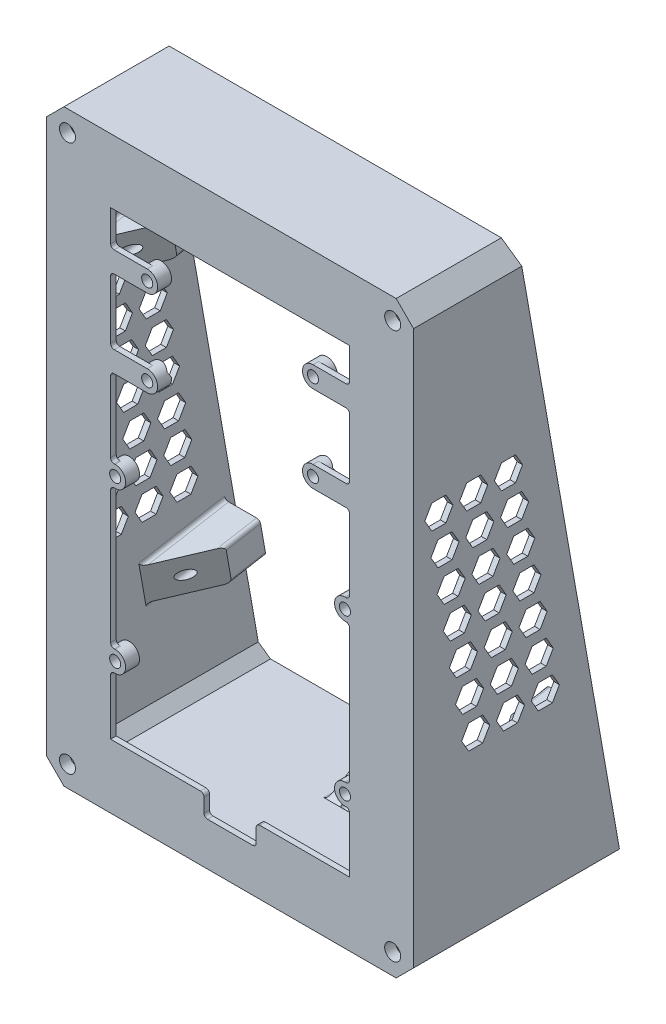
from build123d import *

# Parameters (mm, degrees)
BOSS_EXTRU_3_DEPTH            = 52.7
ENL_V_MAT_EXTRU_2_DEPTH       = 117.264956027171
ENL_V_START                   = -1.6
ENL_V_MAT_EXTRU_3_DEPTH       = 115.664956027171
BOSS_EXTRU_4_START            = -2.4
ESQUISSE11_W                  = 9.99999999999995
ESQUISSE11_H                  = 10
BOSS_EXTRU_4_DEPTH            = 10
BOSS_EXTRU_8_DEPTH            = 10
BOSS_EXTRU_9_DEPTH            = 10
BOSS_EXTRU_11_DEPTH           = 7
BOSS_EXTRU_14_DEPTH           = 10
ESQUISSE29_R                  = 1.3499999999999979
ESQUISSE29_R_2                = 1.3500000000000012
ESQUISSE29_R_3                = 1.3500000000000016
ENL_V_MAT_EXTRU_17_DEPTH      = 24
ESQUISSE30_R                  = 1.600000000000008
ESQUISSE30_R_2                = 1.600000000000006
ESQUISSE30_R_3                = 1.600000000000002
ESQUISSE30_R_4                = 1.3499999999999985
ENL_V_MAT_EXTRU_18_DEPTH      = 6
ESQUISSE18_R                  = 2.300000000000005
ENL_V_MAT_EXTRU_13_DEPTH      = 117.66766129799198
ESQUISSE31_R                  = 3.7000000000000006
ENL_V_MAT_EXTRU_19_DEPTH      = 5.6
ENL_V_MAT_EXTRU_16_REACH      = 118.668
ESQUISSE21_R                  = 1.599999999999998
ESQUISSE21_R_2                = 1.5999999999999974
ESQUISSE21_R_3                = 1.6000000000000019
ESQUISSE21_R_4                = 1.6000000000000008
ESQUISSE22_R                  = 2.9999999999999996
ESQUISSE22_R_2                = 1.599999999999998
ESQUISSE22_R_3                = 3.000000000000002
ESQUISSE22_R_4                = 1.5999999999999974
ESQUISSE22_R_5                = 2.999999999999993
ESQUISSE22_R_6                = 1.6000000000000019
ESQUISSE22_R_7                = 3
ESQUISSE22_R_8                = 1.6000000000000008
ESQUISSE22_R_9                = 2.999999999999998
BOSS_EXTRU_6_DEPTH            = 2.4
BOSS_EXTRU_15_REACH           = 114.487
ENL_V_MAT_EXTRU_20_DEPTH      = 139.71990914336334
ENL_V_MAT_EXTRU_20_DEPTH_BACK = 139.71990914336334
CHANFREIN2_SIZE               = 5
ENL_V_MAT_EXTRU_21_DEPTH      = 117.667661297992
ENL_V_MAT_EXTRU_21_DEPTH_BACK = 117.667661297992
ENL_V_MAT_EXTRU_22_DEPTH      = 1
ENL_V_MAT_EXTRU_23_REACH      = 118.265
CONG_1_R                      = 1


with BuildPart() as part:
    # Esquisse4 → Boss.-Extru.3 (new, symmetric)
    with BuildSketch(Plane(origin=(0, 0, 0), x_dir=(0, 0, -1), z_dir=(1, 0, 0))):
        Polygon((-30.000000000000014, 84.50000000000003), (-29.999999999999993, -84.49999999999997), (30.000000000000007, -84.49999999999997), (0.20074026026995623, 84.50000000000003), align=None)
    extrude(amount=BOSS_EXTRU_3_DEPTH, both=True)

    # Esquisse7 → Enlèv. mat.-Extru.2 (cut, through all)
    with BuildSketch(Plane.XY.offset(30.000000000000004)):
        with BuildLine():
            Line((9.000000000000018, -66.09999999999998), (34.3, -66.09999999999998))
            Line((34.3, -66.09999999999998), (34.3, -49.09999999999998))
            Line((34.3, -49.09999999999998), (32.999999999999964, -49.09999999999998))
            ThreePointArc((32.999999999999964, -49.09999999999999), (30.00000000000001, -46.09999999999998), (32.999999999999964, -43.09999999999997))
            Line((32.999999999999964, -43.09999999999997), (34.300000000000004, -43.09999999999997))
            Line((34.300000000000004, -43.09999999999997), (34.30000000000002, -3.0999999999999672))
            Line((34.30000000000002, -3.0999999999999672), (33.00000000000002, -3.0999999999999672))
            ThreePointArc((33.00000000000002, -3.0999999999999677), (30.000000000000007, -0.09999999999997562), (33.00000000000001, 2.9000000000000314))
            Line((33.00000000000001, 2.900000000000031), (34.3, 2.9000000000000346))
            Line((34.3, 2.900000000000034), (34.29999999999999, 25.300000000000036))
            Line((34.29999999999998, 25.300000000000036), (23.8, 25.300000000000026))
            ThreePointArc((23.8, 25.300000000000026), (20.80000000000001, 28.300000000000022), (23.8, 31.30000000000002))
            Line((23.8, 31.300000000000022), (34.29999999999998, 31.30000000000003))
            Line((34.29999999999999, 31.30000000000003), (34.29999999999998, 50.100000000000016))
            Line((34.29999999999998, 50.100000000000016), (23.8, 50.10000000000002))
            ThreePointArc((23.8, 50.10000000000002), (20.800000000000008, 53.10000000000002), (23.8, 56.10000000000002))
            Line((23.8, 56.100000000000016), (34.29999999999998, 56.1))
            Line((34.29999999999998, 56.1), (34.29999999999998, 66.10000000000004))
            Line((34.29999999999998, 66.10000000000004), (-34.300000000000026, 66.10000000000002))
            Line((-34.300000000000026, 66.10000000000002), (-34.29999999999998, 56.1))
            Line((-34.29999999999998, 56.1), (-23.8, 56.100000000000016))
            ThreePointArc((-23.8, 56.10000000000002), (-20.800000000000008, 53.10000000000002), (-23.8, 50.10000000000002))
            Line((-23.8, 50.10000000000002), (-34.29999999999998, 50.100000000000016))
            Line((-34.29999999999998, 50.100000000000016), (-34.29999999999998, 31.30000000000003))
            Line((-34.29999999999998, 31.30000000000003), (-23.8, 31.300000000000022))
            ThreePointArc((-23.8, 31.30000000000002), (-20.80000000000001, 28.300000000000022), (-23.8, 25.300000000000026))
            Line((-23.8, 25.300000000000026), (-34.29999999999998, 25.300000000000036))
            Line((-34.29999999999998, 25.300000000000036), (-34.29999999999998, 2.900000000000027))
            Line((-34.29999999999998, 2.9000000000000274), (-32.99999999999999, 2.900000000000024))
            ThreePointArc((-32.99999999999999, 2.900000000000024), (-29.999999999999993, -0.09999999999997573), (-32.99999999999999, -3.099999999999975))
            Line((-32.99999999999999, -3.0999999999999743), (-34.29999999999999, -3.0999999999999743))
            Line((-34.29999999999999, -3.0999999999999743), (-34.29999999999999, -43.09999999999997))
            Line((-34.29999999999999, -43.09999999999997), (-33, -43.09999999999997))
            ThreePointArc((-33, -43.09999999999997), (-29.99999999999999, -46.09999999999998), (-33, -49.09999999999999))
            Line((-33, -49.09999999999998), (-34.29999999999998, -49.09999999999998))
            Line((-34.29999999999998, -49.09999999999998), (-34.30000000000001, -66.09999999999998))
            Line((-34.30000000000001, -66.09999999999998), (-8.999999999999979, -66.09999999999998))
            Line((-8.999999999999979, -66.09999999999998), (9.000000000000018, -66.09999999999998))
        make_face()
    extrude(amount=-ENL_V_MAT_EXTRU_2_DEPTH, mode=Mode.SUBTRACT)

    # Esquisse8 → Enlèv. mat.-Extru.3 (cut, through all)
    with BuildSketch(Plane.XY.offset(30.000000000000004).offset(ENL_V_START)):
        Polygon((-51.09999999999999, 82.90000000000003), (-51.09999999999998, -82.9), (51.10000000000001, -82.89999999999999), (51.09999999999999, 82.90000000000005), align=None)
    extrude(amount=-ENL_V_MAT_EXTRU_3_DEPTH, mode=Mode.SUBTRACT)

    # Esquisse11 → Boss.-Extru.4 (add)
    with BuildSketch(Plane(origin=(0, 2.582315378089665, -14.645038256279408), x_dir=(-1, 0, 0), z_dir=(0, 0.17364817766692736, -0.9848077530122086)).offset(BOSS_EXTRU_4_START)):
        Polygon((-41.10000000000003, -42.62215175519405), (-51.10000000000003, -42.62215175519405), (-51.1, -52.62215175519404), (-41.10000000000002, -52.62215175519404), align=None)
        Polygon((51.09999999999997, -52.622151755194054), (51.09999999999998, -42.622151755194054), (41.10000000000003, -42.62215175519405), (41.10000000000003, -52.622151755194054), align=None)
        Polygon((-4.999999999999942, -76.8010178805223), (-4.999999999999939, -86.80101788052231), (5, -86.80101788052228), (5.000000000000001, -76.8010178805223), align=None)
        Polygon((-41.10000000000002, 47.37784824480595), (-51.10000000000003, 47.37784824480595), (-51.099999999999994, 37.37784824480596), (-41.10000000000003, 37.37784824480596), align=None)
        with Locations((46.10000000000001, 42.37784824480596)):
            Rectangle(ESQUISSE11_W, ESQUISSE11_H)
        Polygon((-5.000000000000001, 81.5567143701342), (-4.999999999999998, 71.55671437013419), (5.000000000000002, 71.55671437013419), (5.000000000000001, 81.5567143701342), align=None)
    extrude(amount=-BOSS_EXTRU_4_DEPTH)


with BuildPart() as boss_extru_4_piece_1:
    # of the separate pieces the step leaves, piece 1, a body of its own (boss_extru_4_pieces)
    add(part.part.solids().sort_by_distance((-52.7, 84.5, 30))[0])

    # Esquisse25 → Boss.-Extru.8 (add)
    with BuildSketch(Plane(origin=(0, 46.65807227252074, 8.227077009490785), x_dir=(1, 6.7e-16, 1.2e-16), z_dir=(0, 0.9848077530122086, 0.17364817766692736))):
        Polygon((-41.10000000000003, 12.470961577510904), (-51.09999999999997, 12.470961577510911), (-51.09999999999997, 2.4709615775109115), (-51.099999999999966, -12.529038422489089), (-41.10000000000003, 2.4709615775109044), align=None)
        Polygon((51.099999999999994, 12.47096157751091), (41.10000000000002, 12.470961577510913), (41.10000000000002, 2.470961577510913), (51.099999999999994, -12.529038422489087), (51.099999999999994, 2.470961577510913), align=None)
    extrude(amount=-BOSS_EXTRU_8_DEPTH)

    # Esquisse26 → Boss.-Extru.9 (add)
    with BuildSketch(Plane(origin=(0, -41.974625498578, -7.401258980532674), x_dir=(1, 0, 0), z_dir=(0, 0.9848077530122086, 0.17364817766692736))):
        Polygon((-41.10000000000003, 12.470961577510906), (-51.09999999999997, 12.47096157751091), (-51.09999999999997, 2.4709615775109097), (-51.09999999999997, -12.529038422489124), (-41.10000000000003, 2.4709615775109053), align=None)
        Polygon((51.10000000000001, 12.47096157751091), (41.10000000000003, 12.470961577510913), (41.10000000000003, 2.4709615775109106), (51.100000000000016, -12.52903842248909), (51.10000000000001, 2.4709615775109137), align=None)
    extrude(amount=-BOSS_EXTRU_9_DEPTH)

    # Esquisse28 → Boss.-Extru.11 (add)
    with BuildSketch(Plane(origin=(0, 0, 28.400000000000002), x_dir=(-1, 0, 0), z_dir=(0, 0, -1))):
        with BuildLine():
            Line((-23.600000000000016, 82.90000000000005), (-51.09999999999999, 82.90000000000005))
            Line((-51.09999999999999, 82.90000000000005), (-51.09999999999999, 55.39999999999999))
            ThreePointArc((-51.10000000000001, 55.39999999999999), (-43.045436482630066, 74.84543648263005), (-23.600000000000016, 82.89999999999999))
        make_face()
        with BuildLine():
            ThreePointArc((-23.600000000000016, -82.89999999999999), (-43.045436482630066, -74.84543648263005), (-51.10000000000001, -55.39999999999999))
            Line((-51.10000000000001, -55.39999999999999), (-51.10000000000001, -82.89999999999999))
            Line((-51.10000000000001, -82.89999999999999), (-23.600000000000016, -82.89999999999999))
        make_face()
        with BuildLine():
            Line((51.09999999999999, 82.90000000000003), (23.600000000000016, 82.90000000000003))
            ThreePointArc((23.600000000000016, 82.89999999999999), (43.045436482630066, 74.84543648263005), (51.10000000000001, 55.400000000000006))
            Line((51.09999999999999, 55.400000000000006), (51.09999999999999, 82.90000000000003))
        make_face()
        with BuildLine():
            ThreePointArc((51.10000000000004, -55.39999999999998), (43.045436482630116, -74.84543648263005), (23.60000000000006, -82.89999999999999))
            Line((23.600000000000065, -82.9), (51.09999999999998, -82.9))
            Line((51.09999999999998, -82.9), (51.09999999999998, -55.39999999999998))
        make_face()
    extrude(amount=BOSS_EXTRU_11_DEPTH)



with BuildPart() as boss_extru_4_piece_2:
    # of the separate pieces the step leaves, piece 2, a body of its own (boss_extru_4_pieces)
    add(part.part.solids().sort_by_distance((5, 82.483244374, 1.880675178))[0])


with BuildPart() as boss_extru_4_piece_1_1:
    add(boss_extru_4_piece_1.part)

    add(boss_extru_4_piece_2.part)  # Boss.-Extru.14 merges Boss.-Extru.4 piece 2
    # Esquisse32 → Boss.-Extru.14 (add)
    with BuildSketch(Plane.ZY.offset(5.000000000000001)):
        Polygon((-17.126586843483246, -82.9), (-2.893854273578144, -82.9), (-15.769778916845823, -75.20515987294785), align=None)
        Polygon((1.9541604391222913, 82.90000000000003), (12.108426557979733, 82.90000000000003), (11.72875270794789, 80.74676259693013), (1.8806751778258048, 82.4832443735994), align=None)
        Polygon((9.992270931278615, 70.89868506680803), (26.341159127884836, 82.90000000000003), (12.108426557979733, 82.90000000000003), (11.72875270794789, 80.74676259693013), align=None)
    extrude(amount=-BOSS_EXTRU_14_DEPTH)

    # Esquisse29 → Enlèv. mat.-Extru.17 (cut)
    with BuildSketch(Plane(origin=(0, 2.1655597516890395, -12.281499649050112), x_dir=(-1, 0, 0), z_dir=(0, 0.17364817766692736, -0.9848077530122086))):
        with Locations(Location((-46.100000000000016, 42.37784824480595, 0), (0, 0, 90))):
            Circle(ESQUISSE29_R)
        with Locations(Location((46.1, 42.37784824480596, 0), (0, 0, 90))):
            Circle(ESQUISSE29_R)
        with Locations(Location((-46.100000000000016, -47.62215175519404, 0), (0, 0, 90))):
            Circle(ESQUISSE29_R)
        with Locations(Location((2.949e-14, -81.58942550367213, 0), (0, 0, 90))):
            Circle(ESQUISSE29_R_2)
        with Locations(Location((46.1, -47.62215175519405, 0), (0, 0, 90))):
            Circle(ESQUISSE29_R)
        with Locations(Location((0, 76.76830674698435, 0), (0, 0, 90))):
            Circle(ESQUISSE29_R_3)
    extrude(amount=-ENL_V_MAT_EXTRU_17_DEPTH, mode=Mode.SUBTRACT)

    # Esquisse30 → Enlèv. mat.-Extru.18 (cut)
    # profile 1 of 6: a face of its own
    with BuildSketch(Plane(origin=(0, 2.1655597516890395, -12.281499649050112), x_dir=(-1, 0, 0), z_dir=(0, 0.17364817766692736, -0.9848077530122086))):
        with Locations(Location((-46.100000000000016, 42.37784824480595, 0), (0, 0, 90))):
            Circle(ESQUISSE30_R)
    # profile 2 of 6: a face of its own
    with BuildSketch(Plane(origin=(0, 2.1655597516890395, -12.281499649050112), x_dir=(-1, 0, 0), z_dir=(0, 0.17364817766692736, -0.9848077530122086))):
        with Locations(Location((-46.100000000000016, -47.62215175519404, 0), (0, 0, 90))):
            Circle(ESQUISSE30_R_2)
    # profile 3 of 6: a face of its own
    with BuildSketch(Plane(origin=(0, 2.1655597516890395, -12.281499649050112), x_dir=(-1, 0, 0), z_dir=(0, 0.17364817766692736, -0.9848077530122086))):
        with Locations(Location((2.949e-14, -81.58942550367213, 0), (0, 0, 90))):
            Circle(ESQUISSE30_R_3)
    # profile 4 of 6: a face of its own
    with BuildSketch(Plane(origin=(0, 2.1655597516890395, -12.281499649050112), x_dir=(-1, 0, 0), z_dir=(0, 0.17364817766692736, -0.9848077530122086))):
        with Locations(Location((46.1, -47.62215175519405, 0), (0, 0, 90))):
            Circle(ESQUISSE30_R)
    # profile 5 of 6: a face of its own
    with BuildSketch(Plane(origin=(0, 2.1655597516890395, -12.281499649050112), x_dir=(-1, 0, 0), z_dir=(0, 0.17364817766692736, -0.9848077530122086))):
        with Locations(Location((46.1, 42.37784824480596, 0), (0, 0, 90))):
            Circle(ESQUISSE30_R)
    # profile 6 of 6: a face of its own
    with BuildSketch(Plane(origin=(0, 2.1655597516890395, -12.281499649050112), x_dir=(-1, 0, 0), z_dir=(0, 0.17364817766692736, -0.9848077530122086))):
        with Locations(Location((0, 76.76830674698435, 0), (0, 0, 90))):
            Circle(ESQUISSE30_R_3)
        with Locations(Location((0, 76.76830674698435, 0), (0, 0, 90))):
            Circle(ESQUISSE30_R_4, mode=Mode.SUBTRACT)
    extrude(amount=-ENL_V_MAT_EXTRU_18_DEPTH, mode=Mode.SUBTRACT)

    # Esquisse18 → Enlèv. mat.-Extru.13 (cut, through all)
    with BuildSketch(Plane.XY.offset(30.000000000000004)):
        with Locations((-46.70000000000001, 78.50000000000004)):
            Circle(ESQUISSE18_R)
        with Locations(Location((46.70000000000001, 78.50000000000006, 0), (0, 0, 180))):
            Circle(ESQUISSE18_R)
        with Locations((46.70000000000001, -78.50000000000006)):
            Circle(ESQUISSE18_R)
        with Locations(Location((-46.70000000000001, -78.50000000000004, 0), (0, 0, 180))):
            Circle(ESQUISSE18_R)
    extrude(amount=-ENL_V_MAT_EXTRU_13_DEPTH, mode=Mode.SUBTRACT)

    # Esquisse31 → Enlèv. mat.-Extru.19 (cut)
    with BuildSketch(Plane(origin=(0, 0, 21.400000000000002), x_dir=(-1, 0, 0), z_dir=(0, 0, -1))):
        with Locations((-46.70000000000001, 78.50000000000006)):
            Circle(ESQUISSE31_R)
        with Locations((46.70000000000001, 78.50000000000004)):
            Circle(ESQUISSE31_R)
        with Locations((46.70000000000001, -78.50000000000004)):
            Circle(ESQUISSE31_R)
        with Locations((-46.70000000000001, -78.50000000000006)):
            Circle(ESQUISSE31_R)
    extrude(amount=-ENL_V_MAT_EXTRU_19_DEPTH, mode=Mode.SUBTRACT)

    # Esquisse21 → Enlèv. mat.-Extru.16 (cut, up to next)
    with BuildSketch(Plane.XY.offset(30.000000000000004), mode=Mode.PRIVATE) as enl_v_mat_extru_16_sk1:
        with Locations((-32.99999999999999, -0.09999999999997511)):
            Circle(ESQUISSE21_R)
    enl_v_mat_extru_16_tool1 = extrude(enl_v_mat_extru_16_sk1.sketch, amount=-ENL_V_MAT_EXTRU_16_REACH, mode=Mode.PRIVATE) & boss_extru_4_piece_1_1.part
    # Esquisse21 → Enlèv. mat.-Extru.16 (cut, up to next)
    with BuildSketch(Plane.XY.offset(30.000000000000004), mode=Mode.PRIVATE) as enl_v_mat_extru_16_sk2:
        with Locations((33.00000000000001, -0.09999999999996817)):
            Circle(ESQUISSE21_R)
    enl_v_mat_extru_16_tool2 = extrude(enl_v_mat_extru_16_sk2.sketch, amount=-ENL_V_MAT_EXTRU_16_REACH, mode=Mode.PRIVATE) & boss_extru_4_piece_1_1.part
    # Esquisse21 → Enlèv. mat.-Extru.16 (cut, up to next)
    with BuildSketch(Plane.XY.offset(30.000000000000004), mode=Mode.PRIVATE) as enl_v_mat_extru_16_sk3:
        with Locations((33.00000000000001, -46.09999999999997)):
            Circle(ESQUISSE21_R_2)
    enl_v_mat_extru_16_tool3 = extrude(enl_v_mat_extru_16_sk3.sketch, amount=-ENL_V_MAT_EXTRU_16_REACH, mode=Mode.PRIVATE) & boss_extru_4_piece_1_1.part
    # Esquisse21 → Enlèv. mat.-Extru.16 (cut, up to next)
    with BuildSketch(Plane.XY.offset(30.000000000000004), mode=Mode.PRIVATE) as enl_v_mat_extru_16_sk4:
        with Locations((-32.999999999999986, -46.09999999999997)):
            Circle(ESQUISSE21_R_2)
    enl_v_mat_extru_16_tool4 = extrude(enl_v_mat_extru_16_sk4.sketch, amount=-ENL_V_MAT_EXTRU_16_REACH, mode=Mode.PRIVATE) & boss_extru_4_piece_1_1.part
    # Esquisse21 → Enlèv. mat.-Extru.16 (cut, up to next)
    with BuildSketch(Plane.XY.offset(30.000000000000004), mode=Mode.PRIVATE) as enl_v_mat_extru_16_sk5:
        with Locations((-23.8, 28.300000000000015)):
            Circle(ESQUISSE21_R_3)
    enl_v_mat_extru_16_tool5 = extrude(enl_v_mat_extru_16_sk5.sketch, amount=-ENL_V_MAT_EXTRU_16_REACH, mode=Mode.PRIVATE) & boss_extru_4_piece_1_1.part
    # Esquisse21 → Enlèv. mat.-Extru.16 (cut, up to next)
    with BuildSketch(Plane.XY.offset(30.000000000000004), mode=Mode.PRIVATE) as enl_v_mat_extru_16_sk6:
        with Locations((-23.8, 53.100000000000016)):
            Circle(ESQUISSE21_R_4)
    enl_v_mat_extru_16_tool6 = extrude(enl_v_mat_extru_16_sk6.sketch, amount=-ENL_V_MAT_EXTRU_16_REACH, mode=Mode.PRIVATE) & boss_extru_4_piece_1_1.part
    # Esquisse21 → Enlèv. mat.-Extru.16 (cut, up to next)
    with BuildSketch(Plane.XY.offset(30.000000000000004), mode=Mode.PRIVATE) as enl_v_mat_extru_16_sk7:
        with Locations((23.8, 53.100000000000016)):
            Circle(ESQUISSE21_R_4)
    enl_v_mat_extru_16_tool7 = extrude(enl_v_mat_extru_16_sk7.sketch, amount=-ENL_V_MAT_EXTRU_16_REACH, mode=Mode.PRIVATE) & boss_extru_4_piece_1_1.part
    # Esquisse21 → Enlèv. mat.-Extru.16 (cut, up to next)
    with BuildSketch(Plane.XY.offset(30.000000000000004), mode=Mode.PRIVATE) as enl_v_mat_extru_16_sk8:
        with Locations((23.8, 28.300000000000015)):
            Circle(ESQUISSE21_R_3)
    enl_v_mat_extru_16_tool8 = extrude(enl_v_mat_extru_16_sk8.sketch, amount=-ENL_V_MAT_EXTRU_16_REACH, mode=Mode.PRIVATE) & boss_extru_4_piece_1_1.part
    add(enl_v_mat_extru_16_tool1.solids().sort_by_distance((-33, -0.1, 30))[0], mode=Mode.SUBTRACT)
    add(enl_v_mat_extru_16_tool2.solids().sort_by_distance((33, -0.1, 30))[0], mode=Mode.SUBTRACT)
    add(enl_v_mat_extru_16_tool3.solids().sort_by_distance((33, -46.1, 30))[0], mode=Mode.SUBTRACT)
    add(enl_v_mat_extru_16_tool4.solids().sort_by_distance((-33, -46.1, 30))[0], mode=Mode.SUBTRACT)
    add(enl_v_mat_extru_16_tool5.solids().sort_by_distance((-23.8, 28.3, 30))[0], mode=Mode.SUBTRACT)
    add(enl_v_mat_extru_16_tool6.solids().sort_by_distance((-23.8, 53.1, 30))[0], mode=Mode.SUBTRACT)
    add(enl_v_mat_extru_16_tool7.solids().sort_by_distance((23.8, 53.1, 30))[0], mode=Mode.SUBTRACT)
    add(enl_v_mat_extru_16_tool8.solids().sort_by_distance((23.8, 28.3, 30))[0], mode=Mode.SUBTRACT)

    # Esquisse22 → Boss.-Extru.6 (add)
    # profile 1 of 8: a face of its own
    with BuildSketch(Plane(origin=(0, 0, 28.400000000000002), x_dir=(-1, 0, 0), z_dir=(0, 0, -1))):
        with Locations(Location((-33.00000000000001, -0.09999999999997189, 0), (0, 0, 90))):
            Circle(ESQUISSE22_R)
        with Locations(Location((-33.00000000000001, -0.09999999999997188, 0), (0, 0, 180))):
            Circle(ESQUISSE22_R_2, mode=Mode.SUBTRACT)
    # profile 2 of 8: a face of its own
    with BuildSketch(Plane(origin=(0, 0, 28.400000000000002), x_dir=(-1, 0, 0), z_dir=(0, 0, -1))):
        with Locations(Location((-33, -46.09999999999998, 0), (0, 0, 90))):
            Circle(ESQUISSE22_R_3)
        with Locations(Location((-33.00000000000001, -46.09999999999998, 0), (0, 0, 180))):
            Circle(ESQUISSE22_R_4, mode=Mode.SUBTRACT)
    # profile 3 of 8: a face of its own
    with BuildSketch(Plane(origin=(0, 0, 28.400000000000002), x_dir=(-1, 0, 0), z_dir=(0, 0, -1))):
        with Locations(Location((32.99999999999999, -0.099999999999979, 0), (0, 0, 270))):
            Circle(ESQUISSE22_R)
        with Locations(Location((32.99999999999999, -0.09999999999997881, 0), (0, 0, 180))):
            Circle(ESQUISSE22_R_2, mode=Mode.SUBTRACT)
    # profile 4 of 8: a face of its own
    with BuildSketch(Plane(origin=(0, 0, 28.400000000000002), x_dir=(-1, 0, 0), z_dir=(0, 0, -1))):
        with Locations(Location((32.999999999999986, -46.09999999999998, 0), (0, 0, 270))):
            Circle(ESQUISSE22_R_3)
        with Locations(Location((32.999999999999986, -46.09999999999998, 0), (0, 0, 180))):
            Circle(ESQUISSE22_R_4, mode=Mode.SUBTRACT)
    # profile 5 of 8: a face of its own
    with BuildSketch(Plane(origin=(0, 0, 28.400000000000002), x_dir=(-1, 0, 0), z_dir=(0, 0, -1))):
        with Locations(Location((-23.800000000000004, 28.30000000000002, 0), (0, 0, 90))):
            Circle(ESQUISSE22_R_5)
        with Locations(Location((-23.8, 28.30000000000001, 0), (0, 0, 180))):
            Circle(ESQUISSE22_R_6, mode=Mode.SUBTRACT)
    # profile 6 of 8: a face of its own
    with BuildSketch(Plane(origin=(0, 0, 28.400000000000002), x_dir=(-1, 0, 0), z_dir=(0, 0, -1))):
        with Locations(Location((23.799999999999997, 28.30000000000001, 0), (0, 0, 270))):
            Circle(ESQUISSE22_R_7)
        with Locations(Location((23.8, 28.30000000000001, 0), (0, 0, 180))):
            Circle(ESQUISSE22_R_6, mode=Mode.SUBTRACT)
    # profile 7 of 8: a face of its own
    with BuildSketch(Plane(origin=(0, 0, 28.400000000000002), x_dir=(-1, 0, 0), z_dir=(0, 0, -1))):
        with Locations(Location((23.8, 53.10000000000001, 0), (0, 0, 270))):
            Circle(ESQUISSE22_R_7)
        with Locations(Location((23.8, 53.10000000000001, 0), (0, 0, 180))):
            Circle(ESQUISSE22_R_8, mode=Mode.SUBTRACT)
    # profile 8 of 8: a face of its own
    with BuildSketch(Plane(origin=(0, 0, 28.400000000000002), x_dir=(-1, 0, 0), z_dir=(0, 0, -1))):
        with Locations(Location((-23.800000000000008, 53.10000000000001, 0), (0, 0, 90))):
            Circle(ESQUISSE22_R_9)
        with Locations(Location((-23.8, 53.10000000000001, 0), (0, 0, 180))):
            Circle(ESQUISSE22_R_8, mode=Mode.SUBTRACT)
    extrude(amount=BOSS_EXTRU_6_DEPTH)

    # Boss.-Extru.15: up to this plane
    boss_extru_15_end = Plane(origin=(52.7, 84.50000000000003, -0.20074026026995623), z_dir=(0, -0.17364817766692736, 0.9848077530122087))
    # Esquisse34 → Boss.-Extru.15 (add, up to the surface)
    with BuildSketch(Plane(origin=(0, 0, 21.400000000000002), x_dir=(-1, 0, 0), z_dir=(0, 0, -1)), mode=Mode.PRIVATE) as boss_extru_15_sk1:
        Polygon((-51.09999999999999, 82.90000000000005), (-51.09999999999999, 79.90000000000003), (-48.09999999999998, 82.90000000000005), align=None)
    boss_extru_15_tool1 = split(extrude(boss_extru_15_sk1.sketch, amount=BOSS_EXTRU_15_REACH, mode=Mode.PRIVATE), bisect_by=boss_extru_15_end, keep=Keep.BOTH, mode=Mode.PRIVATE)
    add(boss_extru_15_tool1.solids().sort_by_distance((50.1, 81.9, 21.4))[0])
    # Esquisse34 → Boss.-Extru.15 (add, up to the surface)
    with BuildSketch(Plane(origin=(0, 0, 21.400000000000002), x_dir=(-1, 0, 0), z_dir=(0, 0, -1)), mode=Mode.PRIVATE) as boss_extru_15_sk2:
        Polygon((51.09999999999999, 82.90000000000003), (48.099999999999994, 82.90000000000003), (51.10000000000001, 79.90000000000005), align=None)
    boss_extru_15_tool2 = split(extrude(boss_extru_15_sk2.sketch, amount=BOSS_EXTRU_15_REACH, mode=Mode.PRIVATE), bisect_by=boss_extru_15_end, keep=Keep.BOTH, mode=Mode.PRIVATE)
    add(boss_extru_15_tool2.solids().sort_by_distance((-50.1, 81.9, 21.4))[0])
    # Esquisse34 → Boss.-Extru.15 (add, up to the surface)
    with BuildSketch(Plane(origin=(0, 0, 21.400000000000002), x_dir=(-1, 0, 0), z_dir=(0, 0, -1)), mode=Mode.PRIVATE) as boss_extru_15_sk3:
        Polygon((51.10000000000001, -79.90000000000005), (48.099999999999994, -82.90000000000006), (51.09999999999998, -82.9), align=None)
    boss_extru_15_tool3 = split(extrude(boss_extru_15_sk3.sketch, amount=BOSS_EXTRU_15_REACH, mode=Mode.PRIVATE), bisect_by=boss_extru_15_end, keep=Keep.BOTH, mode=Mode.PRIVATE)
    add(boss_extru_15_tool3.solids().sort_by_distance((-50.1, -81.9, 21.4))[0])
    # Esquisse34 → Boss.-Extru.15 (add, up to the surface)
    with BuildSketch(Plane(origin=(0, 0, 21.400000000000002), x_dir=(-1, 0, 0), z_dir=(0, 0, -1)), mode=Mode.PRIVATE) as boss_extru_15_sk4:
        Polygon((-51.10000000000001, -79.90000000000003), (-51.10000000000001, -82.89999999999999), (-48.09999999999998, -82.89999999999999), align=None)
    boss_extru_15_tool4 = split(extrude(boss_extru_15_sk4.sketch, amount=BOSS_EXTRU_15_REACH, mode=Mode.PRIVATE), bisect_by=boss_extru_15_end, keep=Keep.BOTH, mode=Mode.PRIVATE)
    add(boss_extru_15_tool4.solids().sort_by_distance((50.1, -81.9, 21.4))[0])

    # Esquisse33 → Enlèv. mat.-Extru.20 (cut, two sides: drawn at the far end of the back side and taken through both)
    with BuildSketch(Plane.ZY.offset(52.7).offset(-ENL_V_MAT_EXTRU_20_DEPTH_BACK)):
        Polygon((4.760350298350048, 26.499999999999964), (6.781076240513962, 29.999999999999986), (4.7603502983502874, 33.499999999999986), (0.7188984140226917, 33.499999999999964), (-1.3018275281410039, 29.99999999999998), (0.7188984140228926, 26.50000000000001), align=None)
        Polygon((14.760350298350094, 26.499999999999975), (16.781076240513766, 30.00000000000003), (14.760350298350025, 33.50000000000003), (10.718898414022606, 33.49999999999998), (8.698172471858951, 29.99999999999995), (10.71889841402269, 26.499999999999932), align=None)
        Polygon((24.760350298350094, 26.499999999999975), (26.781076240513762, 30.00000000000003), (24.760350298350026, 33.50000000000003), (20.718898414022608, 33.49999999999998), (18.698172471858953, 29.99999999999995), (20.71889841402269, 26.499999999999932), align=None)
        Polygon((2.997080491265472, 16.49999999999998), (5.01780643342914, 20.000000000000032), (2.9970804912654025, 23.500000000000036), (-1.0443713930620158, 23.499999999999986), (-3.065097335225669, 19.999999999999954), (-1.0443713930619325, 16.49999999999994), align=None)
        Polygon((12.997080491265473, 16.49999999999998), (15.017806433429135, 20.000000000000032), (12.997080491265404, 23.500000000000036), (8.955628606937987, 23.499999999999986), (6.934902664774333, 19.999999999999954), (8.955628606938069, 16.49999999999994), align=None)
        Polygon((22.997080491265475, 16.49999999999998), (25.017806433429143, 20.000000000000032), (22.997080491265407, 23.500000000000036), (18.95562860693799, 23.499999999999986), (16.934902664774334, 19.999999999999954), (18.95562860693807, 16.49999999999994), align=None)
        Polygon((21.233810684180856, 6.499999999999985), (23.254536626344525, 10.000000000000037), (21.23381068418079, 13.500000000000039), (17.19235879985337, 13.499999999999991), (15.171632857689715, 9.999999999999961), (17.19235879985345, 6.499999999999943), align=None)
        Polygon((11.233810684180854, 6.499999999999985), (13.25453662634453, 10.000000000000037), (11.233810684180785, 13.500000000000039), (7.192358799853367, 13.499999999999991), (5.17163285768972, 9.999999999999961), (7.192358799853451, 6.499999999999943), align=None)
        Polygon((1.2338106841808527, 6.499999999999985), (3.25453662634452, 10.000000000000037), (1.2338106841807832, 13.500000000000039), (-2.807641200146635, 13.499999999999991), (-4.828367142310289, 9.999999999999961), (-2.8076412001465516, 6.499999999999943), align=None)
        Polygon((-0.5294591229037665, -3.50000000000001), (1.491266819259901, 4.163e-14), (-0.5294591229038359, 3.500000000000045), (-4.570911007231254, 3.499999999999996), (-6.591636949394908, -3.469e-14), (-4.570911007231171, -3.5000000000000515), align=None)
        Polygon((9.470540877096235, -3.50000000000001), (11.49126681925991, 4.163e-14), (9.470540877096166, 3.500000000000045), (5.4290889927687545, 3.499999999999996), (3.408363050605101, -3.469e-14), (5.429088992768838, -3.5000000000000515), align=None)
        Polygon((19.470540877096237, -3.50000000000001), (21.491266819259906, 4.163e-14), (19.47054087709617, 3.500000000000045), (15.42908899276875, 3.499999999999996), (13.408363050605097, -3.469e-14), (15.429088992768833, -3.5000000000000515), align=None)
        Polygon((17.70727107001162, -13.500000000000005), (19.727997012175287, -9.999999999999954), (17.707271070011547, -6.49999999999995), (13.66581918568413, -6.499999999999999), (11.645093243520478, -10.00000000000003), (13.665819185684214, -13.500000000000046), align=None)
        Polygon((7.7072710700116165, -13.500000000000005), (9.72799701217529, -9.999999999999954), (7.707271070011547, -6.49999999999995), (3.6658191856841356, -6.499999999999999), (1.6450932435204817, -10.00000000000003), (3.6658191856842186, -13.500000000000046), align=None)
        Polygon((-2.292728929988372, -13.500000000000005), (-0.27200298782470433, -9.999999999999954), (-2.292728929988455, -6.49999999999995), (-6.334180814315873, -6.499999999999999), (-8.354906756479513, -10.00000000000003), (-6.33418081431579, -13.500000000000046), align=None)
        Polygon((-4.055998737072991, -23.5), (-2.0352727949093237, -19.999999999999947), (-4.05599873707306, -16.499999999999947), (-8.097450621400478, -16.499999999999993), (-10.118176563564132, -20.000000000000025), (-8.097450621400396, -23.500000000000043), align=None)
        Polygon((5.944001262927011, -23.5), (7.9647272050906714, -19.999999999999947), (5.944001262926927, -16.499999999999947), (1.9025493785995162, -16.499999999999993), (-0.11817656356413742, -20.000000000000025), (1.9025493785995995, -23.500000000000043), align=None)
        Polygon((15.944001262927014, -23.5), (17.964727205090682, -19.999999999999947), (15.94400126292693, -16.499999999999947), (11.902549378599511, -16.499999999999993), (9.881823436435857, -20.000000000000025), (11.902549378599595, -23.500000000000043), align=None)
        Polygon((14.180731455842393, -33.49999999999999), (16.20145739800606, -29.999999999999943), (14.18073145584231, -26.49999999999994), (10.139279571514892, -26.49999999999999), (8.118553629351252, -30.00000000000002), (10.139279571514976, -33.500000000000036), align=None)
        Polygon((-5.819268544157611, -33.49999999999999), (-3.798542601993943, -29.999999999999943), (-5.81926854415768, -26.49999999999994), (-9.860720428485099, -26.49999999999999), (-11.881446370648751, -30.00000000000002), (-9.860720428485015, -33.500000000000036), align=None)
        Polygon((4.180731455842385, -33.49999999999999), (6.201457398006053, -29.999999999999943), (4.180731455842316, -26.49999999999994), (0.139279571514897, -26.49999999999999), (-1.8814463706487565, -30.00000000000002), (0.13927957151498027, -33.500000000000036), align=None)
    extrude(amount=ENL_V_MAT_EXTRU_20_DEPTH + ENL_V_MAT_EXTRU_20_DEPTH_BACK, mode=Mode.SUBTRACT)

    # Chanfrein2
    chanfrein2_edges = [boss_extru_4_piece_1_1.edges().sort_by_distance(p)[0] for p in [
        (-52.7, -84.49999999999997, -7.11e-15),
        (-52.7, 84.50000000000003, 14.899629869865029),
        (52.7, 84.50000000000003, 14.899629869865029),
        (52.7, -84.49999999999997, -7.11e-15),
    ]]
    chamfer(chanfrein2_edges, length=CHANFREIN2_SIZE)

    # Esquisse35 → Enlèv. mat.-Extru.21 (cut, two sides: drawn at the far end of the back side and taken through both)
    with BuildSketch(Plane.XY.offset(30.000000000000004).offset(-ENL_V_MAT_EXTRU_21_DEPTH_BACK)):
        Polygon((47.699999999999974, -84.49999999999997), (-47.699999999999974, -84.49999999999997), (-47.69999999999998, -89.49999999999999), (47.699999999999974, -89.49999999999999), align=None)
    extrude(amount=ENL_V_MAT_EXTRU_21_DEPTH + ENL_V_MAT_EXTRU_21_DEPTH_BACK, mode=Mode.SUBTRACT)

    # Esquisse37 → Enlèv. mat.-Extru.22 (cut)
    with BuildSketch(Plane.XZ.offset(84.49999999999997)):
        with BuildLine():
            Line((-38.499999999999964, 13.199999999999998), (-38.499999999999964, 6.200000000000006))
            ThreePointArc((-38.499999999999964, 6.200000000000006), (-42.69999999999996, 1.9999999999999956), (-46.89999999999997, 6.2000000000000055))
            Line((-46.89999999999997, 6.2000000000000055), (-46.89999999999997, 13.199999999999996))
            ThreePointArc((-46.89999999999997, 13.199999999999996), (-42.699999999999974, 17.400000000000006), (-38.499999999999964, 13.199999999999998))
        make_face()
        with BuildLine():
            Line((38.499999999999964, 13.200000000000006), (38.499999999999964, 6.200000000000016))
            ThreePointArc((38.499999999999964, 6.200000000000016), (42.69999999999996, 2.000000000000006), (46.89999999999997, 6.200000000000017))
            Line((46.89999999999997, 6.200000000000017), (46.89999999999997, 13.200000000000008))
            ThreePointArc((46.89999999999997, 13.200000000000008), (42.699999999999974, 17.400000000000016), (38.499999999999964, 13.200000000000006))
        make_face()
    extrude(amount=-ENL_V_MAT_EXTRU_22_DEPTH, mode=Mode.SUBTRACT)

    # Esquisse38 → Enlèv. mat.-Extru.23 (cut, up to next)
    with BuildSketch(Plane.XY.offset(30.000000000000004), mode=Mode.PRIVATE) as enl_v_mat_extru_23_sk1:
        Polygon((7.499999999999999, -66.1), (7.500000000000001, -72.09999999999998), (-7.499999999999999, -72.1), (-7.499999999999999, -66.1), align=None)
    enl_v_mat_extru_23_tool1 = extrude(enl_v_mat_extru_23_sk1.sketch, amount=-ENL_V_MAT_EXTRU_23_REACH, mode=Mode.PRIVATE) & boss_extru_4_piece_1_1.part
    add(enl_v_mat_extru_23_tool1.solids().sort_by_distance((0, -69.1, 30))[0], mode=Mode.SUBTRACT)

    # Congé1
    cong_1_edges = [boss_extru_4_piece_1_1.edges().sort_by_distance(p)[0] for p in [
        (4.999999999999999, 82.90000000000003, 14.147659783503563),
        (-5.000000000000001, 82.90000000000003, 14.147659783503563),
        (7.499999999999999, -66.1, 29.200000000000003),
        (7.500000000000001, -72.09999999999998, 29.200000000000003),
        (-7.499999999999999, -72.1, 29.200000000000003),
        (-7.499999999999999, -66.1, 29.200000000000003),
        (51.100000000000016, -51.827745497847644, -9.109143493599449),
        (51.10000000000001, 36.80495227325113, 6.519192496424015),
        (-51.099999999999994, -41.97966796772557, -7.372661716930159),
        (-51.09999999999999, 46.65302980337319, 8.255674273093284),
        (4.999999999999969, -82.9, -15.087353617959415),
        (34.29999999999998, 50.10000000000001, 29.200000000000003),
        (34.29999999999998, 31.300000000000026, 29.200000000000003),
        (34.29999999999998, 25.300000000000033, 29.200000000000003),
        (34.3, 2.9000000000000306, 29.200000000000003),
        (34.30000000000002, -3.099999999999971, 29.200000000000003),
        (34.300000000000004, -43.09999999999998, 29.200000000000003),
        (34.3, -49.09999999999999, 29.200000000000003),
        (-34.29999999999998, -49.09999999999999, 29.200000000000003),
        (-34.29999999999999, -43.09999999999998, 29.200000000000003),
        (-34.29999999999999, -3.099999999999978, 29.200000000000003),
        (-34.29999999999998, 2.9000000000000234, 29.200000000000003),
        (-34.29999999999998, 25.300000000000033, 29.200000000000003),
        (-34.29999999999998, 31.300000000000026, 29.200000000000003),
        (-34.29999999999998, 50.10000000000001, 29.200000000000003),
        (-34.29999999999998, 56.099999999999994, 29.200000000000003),
        (34.29999999999998, 56.099999999999994, 29.200000000000003),
        (51.100000000000016, -41.97966796772556, -7.372661716930175),
        (41.10000000000003, -40.677306635223616, -14.758719864521742),
        (41.10000000000002, -50.52538416534569, -16.495201641191017),
        (-51.09999999999999, -51.82774549784766, -9.109143493599433),
        (-41.10000000000003, -50.525384165345706, -16.495201641191017),
        (-41.10000000000003, -40.677306635223616, -14.758719864521742),
        (-5.000000000000001, -82.9, -15.08735361795942),
        (-5.000000000000001, -74.3369189846132, -20.693817681906864),
        (4.999999999999942, -74.3369189846132, -20.693817681906864),
        (41.10000000000002, 47.95539113587516, 0.8696161255017216),
        (41.10000000000003, 38.10731360575308, -0.8668656511675499),
        (51.1, 46.653029803373215, 8.255674273093286),
        (-51.09999999999998, 36.8049522732511, 6.519192496424009),
        (-41.10000000000003, 38.10731360575308, -0.8668656511675499),
        (-41.10000000000003, 47.955391135875175, 0.8696161255017252),
        (-5.000000000000002, 71.76692595514267, 5.068232166217571),
        (4.999999999999998, 71.76692595514267, 5.068232166217571),
    ]]
    fillet(cong_1_edges, radius=CONG_1_R)


solid = boss_extru_4_piece_1_1.part
